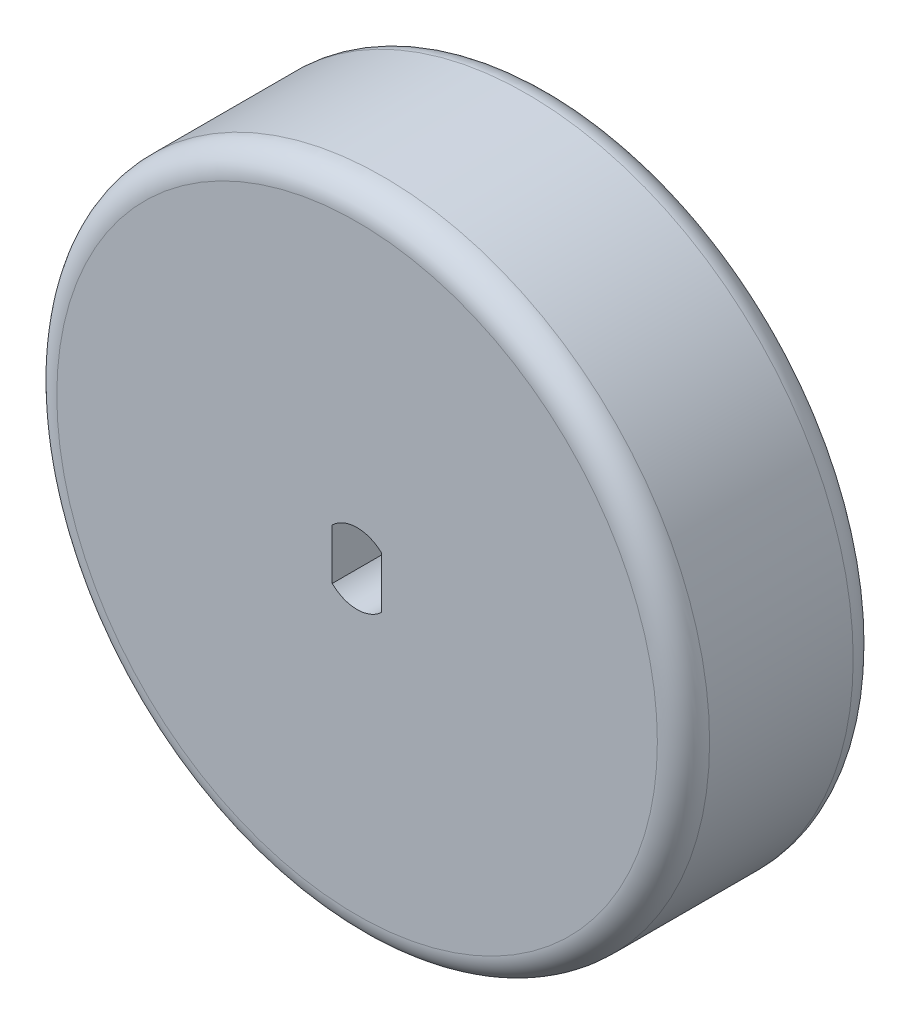
from build123d import *

# Parameters (mm, degrees)
SKETCH1_R           = 25
BOSS_EXTRUDE1_DEPTH = 15
FILLET1_R           = 2
CUT_EXTRUDE1_DEPTH  = 4
SKETCH7_R           = 1.04
CUT_EXTRUDE2_DEPTH  = 39.405728804


with BuildPart() as part:
    # Sketch1 → Boss-Extrude1 (new body)
    with BuildSketch(Plane.XY):
        Circle(SKETCH1_R)
    extrude(amount=BOSS_EXTRUDE1_DEPTH)

    # Fillet1
    fillet1_edges = [part.edges().sort_by_distance(p)[0] for p in [
        (-25, 0, 15),
        (-25, 0, 0),
    ]]
    fillet(fillet1_edges, radius=FILLET1_R)

    # Sketch4 → Cut-Extrude1 (cut)
    with BuildSketch(Plane.XY.offset(15)):
        with BuildLine():
            Line((-1.902969848, 1.941233493), (-1.902969848, -1.941233493))
            ThreePointArc((-1.902969848, -1.941233493), (-0.030378036, -2.71822716), (1.859110772, -1.983277302))
            Line((1.859110772, -1.983277302), (1.859110772, 1.983277302))
            ThreePointArc((1.859110772, 1.983277302), (-0.030378036, 2.71822716), (-1.902969848, 1.941233493))
        make_face()
    extrude(amount=-CUT_EXTRUDE1_DEPTH, mode=Mode.SUBTRACT)

    # Sketch7 → Cut-Extrude2 (cut, through all)
    with BuildSketch(Plane.XY.offset(15)):
        Circle(SKETCH7_R)
    extrude(amount=-CUT_EXTRUDE2_DEPTH, mode=Mode.SUBTRACT)


solid = part.part
